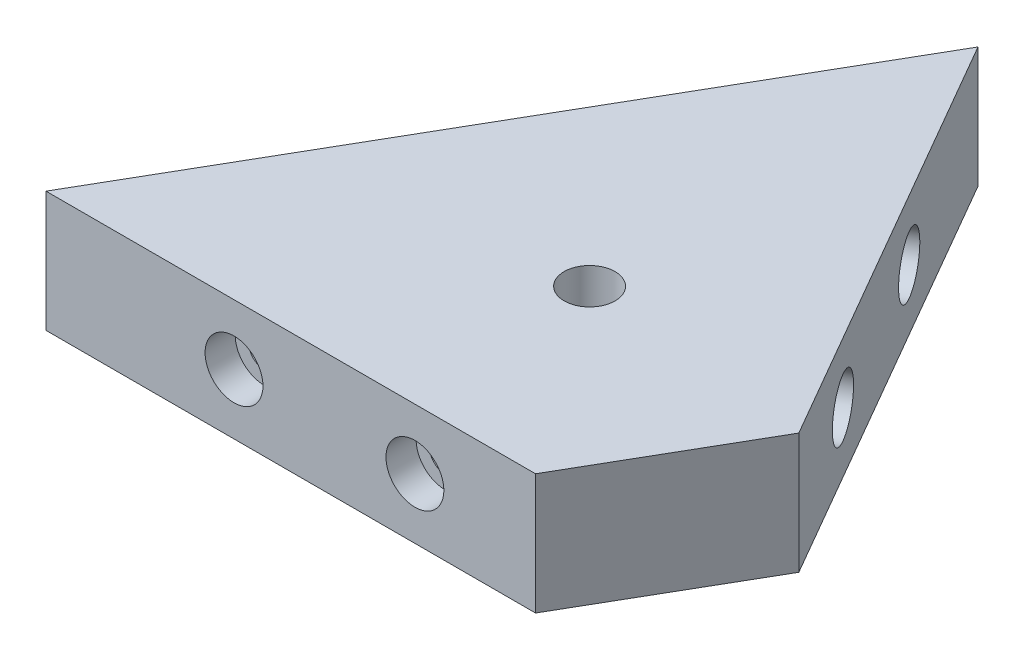
from build123d import *

# Parameters (mm, degrees)
BOSS_EXTRUDE1_DEPTH = 25.4
SKETCH2_R           = 6.096
CUT_EXTRUDE1_DEPTH  = 6.35
SKETCH3_R           = 3.2639
CUT_EXTRUDE2_DEPTH  = 16.51
SKETCH4_R           = 3.2639
CUT_EXTRUDE3_DEPTH  = 16.51
SKETCH5_R           = 5.3578125
CUT_EXTRUDE4_DEPTH  = 280.690442894


with BuildPart() as part:
    # Sketch1 → Boss-Extrude1 (new body)
    with BuildSketch(Plane(origin=(0, 0, 0), x_dir=(1, 0, 0), z_dir=(0, 1, 0))):
        Polygon((119.068292428, -241.162389864), (129.21607637, -223.585912492), (51.895065274, -178.944605922), (15.973610966, -241.162389864), align=None)
    boss_extrude1 = extrude(amount=BOSS_EXTRUDE1_DEPTH)

    # Sketch2 → Cut-Extrude1 (cut)
    with BuildSketch(Plane.XY.offset(241.162389864)):
        with Locations((55.568292428, 12.7)):
            Circle(SKETCH2_R)
        with Locations((93.668292428, 12.7)):
            Circle(SKETCH2_R)
    cut_extrude1 = extrude(amount=-CUT_EXTRUDE1_DEPTH, mode=Mode.SUBTRACT)

    # Sketch3 → Cut-Extrude2 (cut)
    with BuildSketch(Plane.XY.offset(234.812389864)):
        with Locations((55.568292428, 12.7)):
            Circle(SKETCH3_R)
    cut_extrude2 = extrude(amount=-CUT_EXTRUDE2_DEPTH, mode=Mode.SUBTRACT)

    # Sketch4 → Cut-Extrude3 (cut)
    with BuildSketch(Plane.XY.offset(234.812389864)):
        with Locations((93.668292428, 12.7)):
            Circle(SKETCH4_R)
    cut_extrude3 = extrude(amount=-CUT_EXTRUDE3_DEPTH, mode=Mode.SUBTRACT)

    # Mirror1: Boss-Extrude1, Cut-Extrude1, Cut-Extrude2, Cut-Extrude3 across plane
    add(boss_extrude1.mirror(Plane(origin=(51.895065274, 25.4, 178.944605922), x_dir=(0.8660254037844389, 0, 0.4999999999999996), z_dir=(-0.49999999999999983, 0, 0.8660254037844388))))
    add(cut_extrude1.mirror(Plane(origin=(51.895065274, 25.4, 178.944605922), x_dir=(0.8660254037844389, 0, 0.4999999999999996), z_dir=(-0.49999999999999983, 0, 0.8660254037844388))), mode=Mode.SUBTRACT)
    add(cut_extrude2.mirror(Plane(origin=(51.895065274, 25.4, 178.944605922), x_dir=(0.8660254037844389, 0, 0.4999999999999996), z_dir=(-0.49999999999999983, 0, 0.8660254037844388))), mode=Mode.SUBTRACT)
    add(cut_extrude3.mirror(Plane(origin=(51.895065274, 25.4, 178.944605922), x_dir=(0.8660254037844389, 0, 0.4999999999999996), z_dir=(-0.49999999999999983, 0, 0.8660254037844388))), mode=Mode.SUBTRACT)

    # Sketch5 → Cut-Extrude4 (cut, through all)
    with BuildSketch(Plane(origin=(0, 25.4, 0), x_dir=(1, 0, 0), z_dir=(0, 1, 0))):
        with Locations((90.555570822, -201.265259207)):
            Circle(SKETCH5_R)
    extrude(amount=-CUT_EXTRUDE4_DEPTH, mode=Mode.SUBTRACT)


solid = part.part
